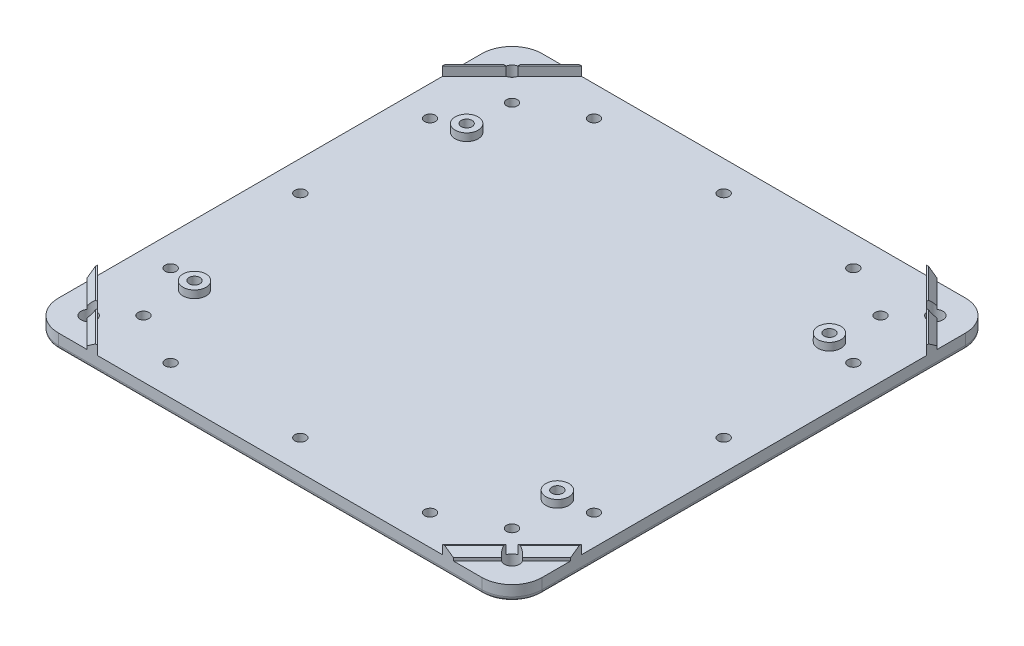
from build123d import *
from build123d.topology import SkipClean

# Parameters (mm, degrees)
SKETCH1_W           = 203.2
SKETCH1_H           = 203.2
BOSS_EXTRUDE1_DEPTH = 6.35
FILLET1_R           = 12.7
SKETCH2_R           = 3.175
CUT_EXTRUDE1_DEPTH  = 288.438345563
FILLET2_R           = 1.905
SKETCH3_R           = 2.286
CUT_EXTRUDE2_DEPTH  = 288.438345563
SKETCH4_R           = 2.286
CUT_EXTRUDE3_DEPTH  = 288.438345563
SKETCH5_R           = 4.826
SKETCH5_R_2         = 2.286
BOSS_EXTRUDE2_DEPTH = 3.175
BOSS_EXTRUDE3_DEPTH = 3.81
CHAMFER1_SIZE       = 2.54


with BuildPart() as part:
    # Sketch1 → Boss-Extrude1 (new body)
    with BuildSketch(Plane(origin=(0, 0, 0), x_dir=(1, 0, 0), z_dir=(0, 1, 0))):
        with Locations((101.6, 101.6)):
            Rectangle(SKETCH1_W, SKETCH1_H)
    extrude(amount=BOSS_EXTRUDE1_DEPTH)

    # Fillet1
    fillet1_edges = [part.edges().sort_by_distance(p)[0] for p in [
        (0, 3.175, -203.2),
        (0, 3.175, 0),
        (203.2, 3.175, 0),
        (203.2, 3.175, -203.2),
    ]]
    fillet(fillet1_edges, radius=FILLET1_R)

    # Sketch2 → Cut-Extrude1 (cut, through all)
    with BuildSketch(Plane.XZ):
        with Locations((12.7, -12.7)):
            Circle(SKETCH2_R)
        with Locations((190.5, -12.7)):
            Circle(SKETCH2_R)
        with Locations((190.5, -190.5)):
            Circle(SKETCH2_R)
        with Locations((12.7, -190.5)):
            Circle(SKETCH2_R)
    extrude(amount=-CUT_EXTRUDE1_DEPTH, mode=Mode.SUBTRACT)

    # Fillet2
    fillet2_edges = [part.edges().sort_by_distance(p)[0] for p in [
        (3.719743879, 0, -3.719743879),
        (101.6, 0, 0),
        (199.480256121, 0, -3.719743879),
        (203.2, 0, -101.6),
        (199.480256121, 0, -199.480256121),
        (101.6, 0, -203.2),
        (3.719743879, 0, -199.480256121),
        (0, 0, -101.6),
        (9.525, 0, -12.7),
        (187.325, 0, -12.7),
        (187.325, 0, -190.5),
        (9.525, 0, -190.5),
    ]]
    fillet(fillet2_edges, radius=FILLET2_R)

    # Sketch3 → Cut-Extrude2 (cut, through all)
    with BuildSketch(Plane(origin=(0, 6.35, 0), x_dir=(1, 0, 0), z_dir=(0, 1, 0))):
        with Locations((24.197781122, 24.197781122)):
            Circle(SKETCH3_R)
        with Locations((179.002218878, 179.002218878)):
            Circle(SKETCH3_R)
        with Locations((179.002218878, 24.197781122)):
            Circle(SKETCH3_R)
        with Locations((24.197781122, 179.002218878)):
            Circle(SKETCH3_R)
    extrude(amount=-CUT_EXTRUDE2_DEPTH, mode=Mode.SUBTRACT)

    # Sketch4 → Cut-Extrude3 (cut, through all)
    with BuildSketch(Plane(origin=(0, 6.35, 0), x_dir=(1, 0, 0), z_dir=(0, 1, 0))):
        with Locations((47.117, 12.7)):
            Circle(SKETCH4_R)
        with Locations((156.083, 12.7)):
            Circle(SKETCH4_R)
        with Locations((12.7, 156.083)):
            Circle(SKETCH4_R)
        with Locations((12.7, 47.117)):
            Circle(SKETCH4_R)
        with Locations((156.083, 190.5)):
            Circle(SKETCH4_R)
        with Locations((47.117, 190.5)):
            Circle(SKETCH4_R)
        with Locations((190.5, 47.117)):
            Circle(SKETCH4_R)
        with Locations((190.5, 156.083)):
            Circle(SKETCH4_R)
        with Locations((101.6, 12.7)):
            Circle(SKETCH4_R)
        with Locations((12.7, 101.6)):
            Circle(SKETCH4_R)
        with Locations((101.6, 190.5)):
            Circle(SKETCH4_R)
        with Locations((190.5, 101.6)):
            Circle(SKETCH4_R)
    extrude(amount=-CUT_EXTRUDE3_DEPTH, mode=Mode.SUBTRACT)

    # Sketch5 → Boss-Extrude2 (add)
    # profile 1 of 4: a face of its own
    with BuildSketch(Plane(origin=(0, 6.35, 0), x_dir=(1, 0, 0), z_dir=(0, 1, 0))):
        with Locations((25.4, 158.75)):
            Circle(SKETCH5_R)
        with Locations((25.4, 158.75)):
            Circle(SKETCH5_R_2, mode=Mode.SUBTRACT)
    # profile 2 of 4: a face of its own
    with BuildSketch(Plane(origin=(0, 6.35, 0), x_dir=(1, 0, 0), z_dir=(0, 1, 0))):
        with Locations((177.8, 158.75)):
            Circle(SKETCH5_R)
        with Locations((177.8, 158.75)):
            Circle(SKETCH5_R_2, mode=Mode.SUBTRACT)
    # profile 3 of 4: a face of its own
    with BuildSketch(Plane(origin=(0, 6.35, 0), x_dir=(1, 0, 0), z_dir=(0, 1, 0))):
        with Locations((177.8, 44.45)):
            Circle(SKETCH5_R)
        with Locations((177.8, 44.45)):
            Circle(SKETCH5_R_2, mode=Mode.SUBTRACT)
    # profile 4 of 4: a face of its own
    with BuildSketch(Plane(origin=(0, 6.35, 0), x_dir=(1, 0, 0), z_dir=(0, 1, 0))):
        with Locations((25.4, 44.45)):
            Circle(SKETCH5_R)
        with Locations((25.4, 44.45)):
            Circle(SKETCH5_R_2, mode=Mode.SUBTRACT)
    extrude(amount=BOSS_EXTRUDE2_DEPTH)

    # Sketch6 → Boss-Extrude3 (add)
    with SkipClean():  # the faces are left unmerged after this step: merging them gives an invalid solid
        with BuildSketch(Plane(origin=(0, 6.35, 0), x_dir=(1, 0, 0), z_dir=(0, 1, 0))):
            with BuildLine():
                Line((203.2, 29.12872), (189.886429467, 15.815149467))
                ThreePointArc((189.886429467, 15.815149467), (191.679620112, 15.647731567), (193.093253903, 14.531845843))
                Line((193.093253903, 14.531845843), (203.2, 24.638591939))
                Line((203.2, 24.638591939), (203.2, 29.12872))
            make_face()
            with BuildLine():
                Line((178.561408061, 0), (174.07128, 0))
                Line((174.07128, 0), (187.384850533, 13.313570533))
                ThreePointArc((187.384850533, 13.313570533), (187.552268433, 11.520379888), (188.668154157, 10.106746097))
                Line((188.668154157, 10.106746097), (178.561408061, 0))
            make_face()
            with BuildLine():
                Line((13.313570533, 15.815149467), (0, 29.12872))
                Line((0, 29.12872), (0, 24.638591939))
                Line((0, 24.638591939), (10.106746097, 14.531845843))
                ThreePointArc((10.106746097, 14.531845843), (11.520379888, 15.647731567), (13.313570533, 15.815149467))
            make_face()
            with BuildLine():
                Line((24.638591939, 0), (14.531845843, 10.106746097))
                ThreePointArc((14.531845843, 10.106746097), (15.647731567, 11.520379888), (15.815149467, 13.313570533))
                Line((15.815149467, 13.313570533), (29.12872, 0))
                Line((29.12872, 0), (24.638591939, 0))
            make_face()
            with BuildLine():
                Line((15.815149467, 189.886429467), (29.12872, 203.2))
                Line((29.12872, 203.2), (24.638591939, 203.2))
                Line((24.638591939, 203.2), (14.531845843, 193.093253903))
                ThreePointArc((14.531845843, 193.093253903), (15.647731567, 191.679620112), (15.815149467, 189.886429467))
            make_face()
            with BuildLine():
                Line((0, 178.561408061), (10.106746097, 188.668154157))
                ThreePointArc((10.106746097, 188.668154157), (11.520379888, 187.552268433), (13.313570533, 187.384850533))
                Line((13.313570533, 187.384850533), (0, 174.07128))
                Line((0, 174.07128), (0, 178.561408061))
            make_face()
            with BuildLine():
                Line((189.886429467, 187.384850533), (203.2, 174.07128))
                Line((203.2, 174.07128), (203.2, 178.561408061))
                Line((203.2, 178.561408061), (193.093253903, 188.668154157))
                ThreePointArc((193.093253903, 188.668154157), (191.679620112, 187.552268433), (189.886429467, 187.384850533))
            make_face()
            with BuildLine():
                Line((178.561408061, 203.2), (188.668154157, 193.093253903))
                ThreePointArc((188.668154157, 193.093253903), (187.552268433, 191.679620112), (187.384850533, 189.886429467))
                Line((187.384850533, 189.886429467), (174.07128, 203.2))
                Line((174.07128, 203.2), (178.561408061, 203.2))
            make_face()
        extrude(amount=BOSS_EXTRUDE3_DEPTH)

    # Chamfer1
    chamfer1_edges = [part.edges().sort_by_distance(p)[0] for p in [
        (198.146626952, 10.16, -19.585218891),
        (183.614781109, 10.16, -5.053373048),
        (198.146626952, 10.16, -183.614781109),
        (183.614781109, 10.16, -198.146626952),
        (19.585218891, 10.16, -198.146626952),
        (5.053373048, 10.16, -183.614781109),
        (19.585218891, 10.16, -5.053373048),
        (5.053373048, 10.16, -19.585218891),
    ]]
    chamfer(chamfer1_edges, length=CHAMFER1_SIZE)


solid = part.part
